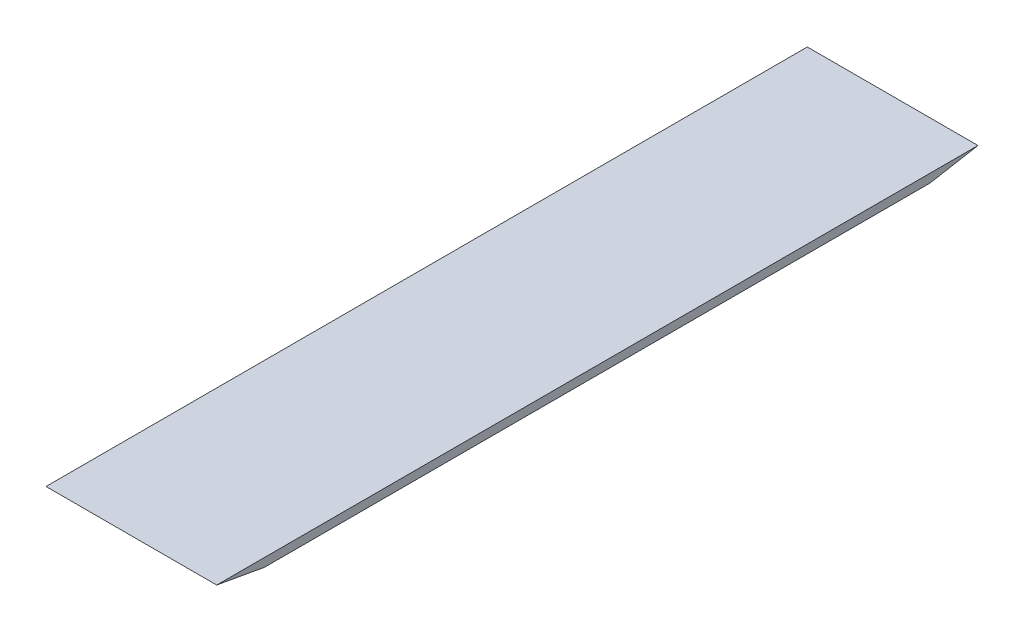
from build123d import *

# Parameters (mm, degrees)
BOSS_EXTRUDE1_DEPTH = 100


with BuildPart() as part:
    # Sketch1 → Boss-Extrude1 (new body)
    with BuildSketch(Plane(origin=(0, 0, 0), x_dir=(0, 0, -1), z_dir=(1, 0, 0))):
        Polygon((0, 0), (446, 0), (418, -5), (28, -5), align=None)
    extrude(amount=BOSS_EXTRUDE1_DEPTH)


solid = part.part
